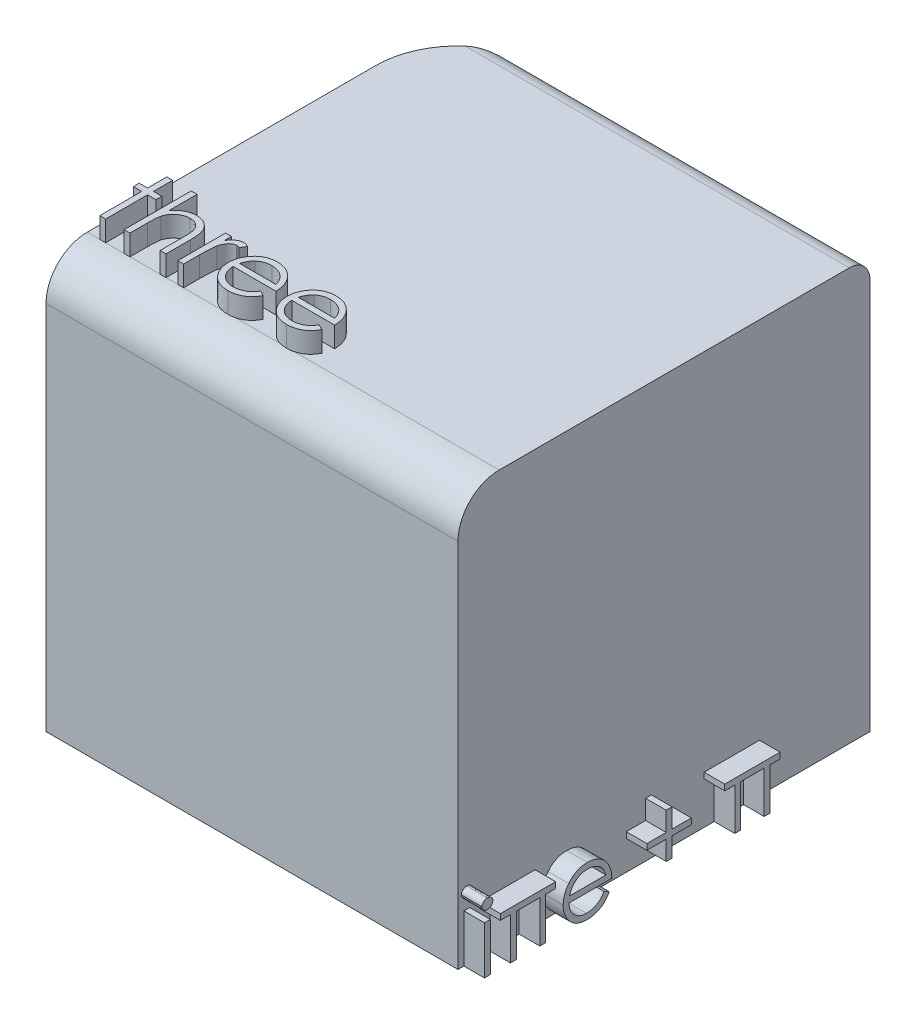
from build123d import *
from OCP.BRepFilletAPI import BRepFilletAPI_MakeFillet

# Parameters (mm, degrees)
SKETCH2_W           = 20
SKETCH2_H           = 20
BOSS_EXTRUDE1_DEPTH = 20
SKETCH3_W           = 0.284935898
SKETCH3_H           = 2.320192308
BOSS_EXTRUDE2_DEPTH = 1
FILLET1_R1          = 2
FILLET1_R2          = 1
FILLET1_R3          = 4
BOSS_EXTRUDE3_DEPTH = 1
SKETCH5_R           = 0.869274054
SKETCH5_R_2         = 1.87334708
SKETCH5_R_3         = 1.224259222
SKETCH5_R_4         = 0.854359486
SKETCH5_R_5         = 0.723058737
SKETCH5_R_6         = 0.828150602
SKETCH5_R_7         = 1.20534194
SKETCH5_R_8         = 2.196982283
SKETCH5_R_9         = 1.648859169
SKETCH5_R_10        = 0.887298728
SKETCH5_R_11        = 1.198491665
SKETCH5_R_12        = 1.240938395
SKETCH5_R_13        = 1.52286101
SKETCH5_R_14        = 2.08407997
SKETCH5_R_15        = 1.116428312
SKETCH5_R_16        = 0.510356374
SKETCH5_R_17        = 0.928303522
SKETCH5_R_18        = 1.048285303
SKETCH5_R_19        = 1.120954627
SKETCH5_R_20        = 1.035138007
SKETCH5_R_21        = 1.063032749
SKETCH5_R_22        = 0.901829478
SKETCH5_R_23        = 0.83084329
SKETCH5_R_24        = 0.806786337
SKETCH5_R_25        = 0.775997991
SKETCH5_R_26        = 0.848871038
SKETCH5_R_27        = 0.739481873
SKETCH5_R_28        = 1.066466648
SKETCH5_R_29        = 0.843889534
SKETCH5_R_30        = 0.704115082
SKETCH5_R_31        = 0.319725843
SKETCH5_R_32        = 0.681387214
SKETCH5_R_33        = 0.790534868
SKETCH5_R_34        = 0.573713006
SKETCH5_R_35        = 0.533233324
SKETCH5_R_36        = 0.625054899
SKETCH5_R_37        = 0.340042365
SKETCH5_R_38        = 0.519725647
SKETCH5_R_39        = 0.813729973
SKETCH5_R_40        = 0.720290961
SKETCH5_R_41        = 0.811333119
SKETCH5_R_42        = 0.907849135
SKETCH5_R_43        = 0.760866236
SKETCH5_R_44        = 0.443440105
SKETCH5_R_45        = 0.505502597
SKETCH5_R_46        = 0.653372918
SKETCH5_R_47        = 0.821463246
SKETCH5_R_48        = 0.243410693
SKETCH5_R_49        = 0.331818637
SKETCH5_R_50        = 0.58557289
SKETCH5_R_51        = 0.913548579
SKETCH5_R_52        = 0.618089992
SKETCH5_R_53        = 0.33645039
SKETCH5_R_54        = 0.353045631
SKETCH5_R_55        = 0.558214156
SKETCH5_R_56        = 0.708578995
SKETCH5_R_57        = 0.386937988
SKETCH5_R_58        = 0.620695254
SKETCH5_R_59        = 0.450911284
SKETCH5_R_60        = 0.446571325
SKETCH5_R_61        = 0.637073751
SKETCH5_R_62        = 0.354108624
SKETCH5_R_63        = 0.719749999
SKETCH5_RX          = 0.571418379
SKETCH5_RY          = 0.334928494
BOSS_EXTRUDE4_DEPTH = 4


with BuildPart() as part:
    # Sketch2 → Boss-Extrude1 (new body)
    with BuildSketch(Plane(origin=(0, 0, 0), x_dir=(1, 0, 0), z_dir=(0, 1, 0))):
        with Locations((10, -10)):
            Rectangle(SKETCH2_W, SKETCH2_H)
    extrude(amount=BOSS_EXTRUDE1_DEPTH)

    # Sketch3 → Boss-Extrude2 (add)
    # profile 1 of 6: a face of its own
    with BuildSketch(Plane(origin=(20, 0, 0), x_dir=(0, 0, -1), z_dir=(1, 0, 0))):
        with BuildLine():
            add(Edge.make_bspline(
                [(-19.573868189, 3.297115385), (-19.556186781, 3.296295189), (-19.521563189, 3.294689089), (-19.47149501, 3.280935463), (-19.425904721, 3.257622177), (-19.385466349, 3.226344181), (-19.350766423, 3.189560043), (-19.326472493, 3.146687593), (-19.310858391, 3.100370114), (-19.308972844, 3.06806214), (-19.308012821, 3.05161258)],
                knots=[0, 0, 0, 0, 1.055194115, 2.066272739, 3.074728998, 4.095836921, 5.109056067, 6.073838105, 7.019297344, 8, 8, 8, 8], degree=3))
            add(Edge.make_bspline(
                [(-19.308012821, 3.05161258), (-19.308994494, 3.03559003), (-19.310935147, 3.003915346), (-19.326460432, 2.958400839), (-19.350973462, 2.916124096), (-19.385444098, 2.879411381), (-19.425910617, 2.848150675), (-19.471493444, 2.824832805), (-19.521563601, 2.811080395), (-19.55618692, 2.809474127), (-19.573868189, 2.808653846)],
                knots=[0, 0, 0, 0, 0.96129708, 1.900370562, 2.859976407, 3.87933698, 4.906634145, 5.921202961, 6.938410037, 8, 8, 8, 8], degree=3))
            add(Edge.make_bspline(
                [(-19.573868189, 2.808653846), (-19.591347267, 2.809442807), (-19.625368009, 2.810978415), (-19.674686502, 2.825102646), (-19.71988806, 2.848158655), (-19.760405299, 2.879206694), (-19.794178403, 2.916349565), (-19.818760455, 2.958375039), (-19.834249885, 3.003921915), (-19.836195369, 3.035592237), (-19.837179487, 3.05161258)],
                knots=[0, 0, 0, 0, 1.054934014, 2.053291228, 3.073705704, 4.106921865, 5.123545215, 6.088680038, 7.033164197, 8, 8, 8, 8], degree=3))
            add(Edge.make_bspline(
                [(-19.837179487, 3.05161258), (-19.83621693, 3.068059851), (-19.834326407, 3.100363328), (-19.818748845, 3.146713822), (-19.794383162, 3.189332756), (-19.760382936, 3.226548745), (-19.719894012, 3.257614247), (-19.674684964, 3.280665637), (-19.625368416, 3.294791066), (-19.591347405, 3.296326509), (-19.573868189, 3.297115385)],
                knots=[0, 0, 0, 0, 0.98631895, 1.937192651, 2.907499808, 3.917963147, 4.944918757, 5.95915025, 6.951458133, 8, 8, 8, 8], degree=3))
        make_face()
    # profile 2 of 6: a face of its own
    with BuildSketch(Plane(origin=(20, 0, 0), x_dir=(0, 0, -1), z_dir=(1, 0, 0))):
        with Locations((-19.572596154, 1.160096154)):
            Rectangle(SKETCH3_W, SKETCH3_H)
    # profile 3 of 6: a face of its own
    with BuildSketch(Plane(origin=(20, 0, 0), x_dir=(0, 0, -1), z_dir=(1, 0, 0))):
        Polygon((-16.256585145, 2.03525641), (-16.745046683, 2.03525641), (-16.745046683, 0), (-17.029982581, 0), (-17.029982581, 2.03525641), (-18.169726171, 2.03525641), (-18.169726171, 0), (-18.454662068, 0), (-18.454662068, 2.03525641), (-18.943123606, 2.03525641), (-18.943123606, 2.320192308), (-16.256585145, 2.320192308), align=None)
    # profile 4 of 6: a face of its own
    with BuildSketch(Plane(origin=(20, 0, 0), x_dir=(0, 0, -1), z_dir=(1, 0, 0))):
        with BuildLine():
            Line((-13.909152811, 0.732692308), (-13.656017795, 0.599764623))
            add(Edge.make_bspline(
                [(-13.656017795, 0.599764623), (-13.676189563, 0.563983887), (-13.715435837, 0.494368744), (-13.782927944, 0.398726985), (-13.853677895, 0.312686557), (-13.930879352, 0.238546085), (-14.012222561, 0.1739109), (-14.098158612, 0.117361587), (-14.189134897, 0.069175501), (-14.285155718, 0.028578565), (-14.387027454, -0.002635762), (-14.494996972, -0.024683162), (-14.609271115, -0.038311413), (-14.687599435, -0.039894505), (-14.727707498, -0.040705128)],
                knots=[0, 0, 0, 0, 1.120438281, 2.179929193, 3.190490725, 4.156257408, 5.095198341, 6.022838206, 6.959905092, 7.901321166, 8.864066838, 9.862729781, 10.905609505, 12, 12, 12, 12], degree=3))
            add(Edge.make_bspline(
                [(-14.727707498, -0.040705128), (-14.772286292, -0.039664476), (-14.859246605, -0.037634466), (-14.985829089, -0.020133445), (-15.10500899, 0.008416481), (-15.216779607, 0.048299508), (-15.320867222, 0.100394295), (-15.417478712, 0.163857539), (-15.507122139, 0.238363227), (-15.586972671, 0.324556715), (-15.658858193, 0.416796776), (-15.722290902, 0.5129139), (-15.775320143, 0.612666254), (-15.818457153, 0.7154188), (-15.853295852, 0.820523904), (-15.877577076, 0.928937878), (-15.891574062, 1.040367301), (-15.893718952, 1.115748455), (-15.894799846, 1.153735978)],
                knots=[0, 0, 0, 0, 1.145258523, 2.234067595, 3.276747158, 4.290159414, 5.277019952, 6.260822364, 7.254936242, 8.264827045, 9.274100331, 10.257902744, 11.220704747, 12.172965371, 13.118907548, 14.062713208, 15.023725156, 16, 16, 16, 16], degree=3))
            add(Edge.make_bspline(
                [(-15.894799846, 1.153735978), (-15.893839054, 1.189382002), (-15.89193489, 1.260027716), (-15.879932675, 1.364590031), (-15.858661724, 1.466215842), (-15.829473201, 1.564989591), (-15.791780285, 1.660745898), (-15.745668201, 1.753543042), (-15.691065115, 1.843282276), (-15.648907761, 1.899890833), (-15.627672442, 1.928405449)],
                knots=[0, 0, 0, 0, 1.024358464, 2.0301432, 3.019427413, 4.004406732, 4.986367066, 5.972626655, 6.978780325, 8, 8, 8, 8], degree=3))
            add(Edge.make_bspline(
                [(-15.627672442, 1.928405449), (-15.598909044, 1.962757924), (-15.5422934, 2.030374674), (-15.446538706, 2.119218727), (-15.342852099, 2.193644152), (-15.232532981, 2.25533634), (-15.11429918, 2.302211719), (-14.989740037, 2.337143598), (-14.857437256, 2.356717936), (-14.766990377, 2.359482757), (-14.720711304, 2.360897436)],
                knots=[0, 0, 0, 0, 1.030682036, 2.02871468, 2.997146059, 3.962720338, 4.930598197, 5.918074684, 6.934738563, 8, 8, 8, 8], degree=3))
            add(Edge.make_bspline(
                [(-14.720711304, 2.360897436), (-14.673133834, 2.35966912), (-14.579797682, 2.357259445), (-14.443697115, 2.334919842), (-14.314918465, 2.299493596), (-14.193513265, 2.249461229), (-14.079469206, 2.18490935), (-13.973527575, 2.104952108), (-13.87387656, 2.012044272), (-13.815902349, 1.940594789), (-13.786401409, 1.904236779)],
                knots=[0, 0, 0, 0, 1.056321875, 2.072262726, 3.055038591, 4.01806755, 4.982017516, 5.957941055, 6.960871419, 8, 8, 8, 8], degree=3))
            add(Edge.make_bspline(
                [(-13.786401409, 1.904236779), (-13.766329115, 1.876837816), (-13.726318134, 1.822222265), (-13.676201121, 1.733167001), (-13.632696913, 1.639993819), (-13.597923441, 1.541196621), (-13.56976618, 1.437946002), (-13.549394637, 1.329503836), (-13.537447911, 1.215902417), (-13.535099593, 1.138499042), (-13.53390241, 1.099038462)],
                knots=[0, 0, 0, 0, 0.94817472, 1.890038105, 2.849395472, 3.817997239, 4.812318967, 5.836947057, 6.897266129, 8, 8, 8, 8], degree=3))
            Line((-13.53390241, 1.099038462), (-15.609863949, 1.099038462))
            add(Edge.make_bspline(
                [(-15.609863949, 1.099038462), (-15.608467306, 1.068467326), (-15.605720864, 1.008350421), (-15.592916412, 0.920384068), (-15.572733596, 0.836588251), (-15.544368089, 0.757591491), (-15.510017451, 0.682362018), (-15.467938979, 0.611457885), (-15.417738098, 0.545202048), (-15.361744071, 0.483001859), (-15.29941692, 0.427611026), (-15.233846142, 0.378034057), (-15.164092694, 0.336481837), (-15.090706576, 0.302754366), (-15.013806456, 0.276350779), (-14.933368108, 0.258327828), (-14.849549816, 0.246256381), (-14.792412758, 0.244914113), (-14.763324485, 0.244230769)],
                knots=[0, 0, 0, 0, 1.094153842, 2.151609401, 3.174256925, 4.172055639, 5.149267565, 6.128595816, 7.11444997, 8.118368179, 9.117203808, 10.09244225, 11.054858984, 12.015122123, 12.976791628, 13.957293641, 14.960065497, 16, 16, 16, 16], degree=3))
            add(Edge.make_bspline(
                [(-14.763324485, 0.244230769), (-14.734884516, 0.244782363), (-14.678454161, 0.245876832), (-14.594415669, 0.256519351), (-14.511739097, 0.273728102), (-14.430766634, 0.297214021), (-14.353141652, 0.325858737), (-14.281254617, 0.360423472), (-14.21514185, 0.398659314), (-14.153350031, 0.442392376), (-14.093414201, 0.495921231), (-14.033957803, 0.56271935), (-13.970206839, 0.641720179), (-13.930301994, 0.701179461), (-13.909152811, 0.732692308)],
                knots=[0, 0, 0, 0, 0.99110716, 1.966546729, 2.947904876, 3.932708344, 4.903319531, 5.828989031, 6.710028674, 7.56322171, 8.463672341, 9.504779593, 10.677557249, 12, 12, 12, 12], degree=3))
        make_face()
        with BuildLine():
            add(Edge.make_bspline(
                [(-13.818838308, 1.383974359), (-13.829267388, 1.421768537), (-13.849340012, 1.494510165), (-13.891283, 1.595240115), (-13.938519326, 1.68476414), (-13.994419039, 1.762397092), (-14.057754598, 1.831343136), (-14.130911299, 1.891594282), (-14.212949574, 1.945494398), (-14.303445366, 1.990989879), (-14.399277556, 2.02971568), (-14.499613173, 2.055682749), (-14.60199131, 2.073471405), (-14.671237412, 2.075127947), (-14.706082899, 2.075961538)],
                knots=[0, 0, 0, 0, 1.154881502, 2.222775134, 3.210006277, 4.132804581, 5.035138423, 5.962687519, 6.919655026, 7.923214229, 8.944639381, 9.960483929, 10.97369054, 12, 12, 12, 12], degree=3))
            add(Edge.make_bspline(
                [(-14.706082899, 2.075961538), (-14.734521318, 2.075406665), (-14.790738094, 2.074309797), (-14.873561206, 2.063904751), (-14.953099219, 2.046705463), (-15.029939015, 2.023151538), (-15.10307366, 1.991756592), (-15.174007485, 1.954941807), (-15.240936845, 1.910000514), (-15.282793592, 1.875747838), (-15.303939469, 1.85844351)],
                knots=[0, 0, 0, 0, 1.04873581, 2.073130211, 3.073294108, 4.04793562, 5.032784715, 6.005352987, 6.992311501, 8, 8, 8, 8], degree=3))
            add(Edge.make_bspline(
                [(-15.303939469, 1.85844351), (-15.319082661, 1.844750809), (-15.34972879, 1.81704012), (-15.390677691, 1.769297911), (-15.429884835, 1.717816137), (-15.465566077, 1.660625203), (-15.498293602, 1.598376353), (-15.528918724, 1.531594641), (-15.55648354, 1.459773302), (-15.571992154, 1.409724017), (-15.57997112, 1.383974359)],
                knots=[0, 0, 0, 0, 0.879870761, 1.780643979, 2.707998968, 3.669668524, 4.684282772, 5.740141944, 6.837334558, 8, 8, 8, 8], degree=3))
            Line((-15.57997112, 1.383974359), (-13.818838308, 1.383974359))
        make_face(mode=Mode.SUBTRACT)
    # profile 5 of 6: a face of its own
    with BuildSketch(Plane(origin=(20, 0, 0), x_dir=(0, 0, -1), z_dir=(1, 0, 0))):
        Polygon((-10.894403598, 1.709615385), (-10.894403598, 2.645833333), (-10.6094677, 2.645833333), (-10.6094677, 1.709615385), (-9.673249751, 1.709615385), (-9.673249751, 1.424679487), (-10.6094677, 1.424679487), (-10.6094677, 0.488461538), (-10.894403598, 0.488461538), (-10.894403598, 1.424679487), (-11.830621546, 1.424679487), (-11.830621546, 1.709615385), align=None)
    # profile 6 of 6: a face of its own
    with BuildSketch(Plane(origin=(20, 0, 0), x_dir=(0, 0, -1), z_dir=(1, 0, 0))):
        Polygon((-5.364587302, 2.03525641), (-5.85304884, 2.03525641), (-5.85304884, 0), (-6.137984738, 0), (-6.137984738, 2.03525641), (-7.277728327, 2.03525641), (-7.277728327, 0), (-7.562664225, 0), (-7.562664225, 2.03525641), (-8.051125763, 2.03525641), (-8.051125763, 2.320192308), (-5.364587302, 2.320192308), align=None)
    extrude(amount=BOSS_EXTRUDE2_DEPTH)

    # Fillet1: one fillet with a radius per group of edges: ONE call of the kernel's fillet builder (fillet() takes one radius for all edges)
    fillet1_edges_1 = [part.edges().sort_by_distance(p)[0] for p in [
        (10, 20, 20),
    ]]
    fillet1_edges_2 = [part.edges().sort_by_distance(p)[0] for p in [
        (10, 20, 0),
    ]]
    fillet1_edges_3 = [part.edges().sort_by_distance(p)[0] for p in [
        (0, 10, 0),
    ]]
    fillet1 = BRepFilletAPI_MakeFillet(part.part.solid().wrapped)
    for e in fillet1_edges_1:
        fillet1.Add(FILLET1_R1, e.wrapped)
    for e in fillet1_edges_2:
        fillet1.Add(FILLET1_R2, e.wrapped)
    for e in fillet1_edges_3:
        fillet1.Add(FILLET1_R3, e.wrapped)
    add(Compound.cast(fillet1.Shape()), mode=Mode.REPLACE)

    # Sketch4 → Boss-Extrude3 (add)
    # profile 1 of 5: a face of its own
    with BuildSketch(Plane(origin=(0, 20, 0), x_dir=(1, 0, 0), z_dir=(0, 1, 0))):
        Polygon((0.610576923, -14.743589744), (0.895512821, -14.743589744), (0.895512821, -15.679807692), (1.302564103, -15.679807692), (1.302564103, -15.96474359), (0.895512821, -15.96474359), (0.895512821, -18), (0.610576923, -18), (0.610576923, -15.96474359), (0.203525641, -15.96474359), (0.203525641, -15.679807692), (0.610576923, -15.679807692), align=None)
    # profile 2 of 5: a face of its own
    with BuildSketch(Plane(origin=(0, 20, 0), x_dir=(1, 0, 0), z_dir=(0, 1, 0))):
        with BuildLine():
            Line((1.791025641, -14.743589744), (2.075961538, -14.743589744))
            Line((2.075961538, -14.743589744), (2.075961538, -16.118023838))
            add(Edge.make_bspline(
                [(2.075961538, -16.118023838), (2.106547948, -16.079793226), (2.166101254, -16.005356265), (2.266337017, -15.90823647), (2.369271308, -15.824054864), (2.478459386, -15.757043806), (2.591898072, -15.704106085), (2.710065807, -15.666561577), (2.832984545, -15.643473796), (2.916464502, -15.640572374), (2.958754006, -15.639102564)],
                knots=[0, 0, 0, 0, 1.125788106, 2.19196713, 3.20547328, 4.180437432, 5.132270164, 6.079753143, 7.027236121, 8, 8, 8, 8], degree=3))
            add(Edge.make_bspline(
                [(2.958754006, -15.639102564), (3.001689434, -15.640685919), (3.085724423, -15.643784926), (3.208081178, -15.668289921), (3.322345686, -15.710161311), (3.428178272, -15.767462827), (3.523269248, -15.83883032), (3.607497248, -15.921227487), (3.676295687, -16.01672597), (3.723103457, -16.104951286), (3.753559334, -16.183454299), (3.772837777, -16.250797421), (3.789183764, -16.325838013), (3.803425667, -16.408537449), (3.81291763, -16.499292712), (3.82054182, -16.597694357), (3.825963317, -16.703736743), (3.826173416, -16.777142969), (3.826282051, -16.815099159)],
                knots=[0, 0, 0, 0, 1.235656852, 2.418478516, 3.575258207, 4.727955599, 5.870717718, 6.98870536, 8.107142894, 9.245821548, 9.854588956, 10.528768408, 11.260415777, 12.065282286, 12.943670737, 13.886611085, 14.907229059, 16, 16, 16, 16], degree=3))
            Line((3.826282051, -16.815099159), (3.826282051, -18))
            Line((3.826282051, -18), (3.541346154, -18))
            Line((3.541346154, -18), (3.541346154, -16.90859375))
            add(Edge.make_bspline(
                [(3.541346154, -16.90859375), (3.541173522, -16.877004614), (3.540843306, -16.816579973), (3.5397517, -16.730069289), (3.537314919, -16.651604938), (3.53337717, -16.581438389), (3.529235784, -16.519471821), (3.523535918, -16.465795221), (3.516904491, -16.420334868), (3.510945668, -16.392971241), (3.508273237, -16.380699119)],
                knots=[0, 0, 0, 0, 1.430932559, 2.737130458, 3.918967929, 4.986496826, 5.920444988, 6.731744033, 7.431208747, 8, 8, 8, 8], degree=3))
            add(Edge.make_bspline(
                [(3.508273237, -16.380699119), (3.497909815, -16.344690751), (3.477986196, -16.275464874), (3.431678388, -16.181428259), (3.373839856, -16.101250672), (3.303221269, -16.03601414), (3.221071896, -15.984840815), (3.126856071, -15.949400755), (3.021460524, -15.927404607), (2.947209546, -15.925191811), (2.908508614, -15.924038462)],
                knots=[0, 0, 0, 0, 1.090059168, 2.095632401, 3.037101401, 3.955032261, 4.878929692, 5.839099886, 6.873700383, 8, 8, 8, 8], degree=3))
            add(Edge.make_bspline(
                [(2.908508614, -15.924038462), (2.885587134, -15.924470104), (2.840226117, -15.925324313), (2.772962685, -15.93390035), (2.707712748, -15.947914544), (2.643847916, -15.966877947), (2.582721729, -15.992682113), (2.522552463, -16.022554499), (2.465044859, -16.059119844), (2.409177725, -16.100146076), (2.357182534, -16.145566501), (2.308807222, -16.193506239), (2.265683157, -16.244555671), (2.226613792, -16.297895776), (2.192887776, -16.354258189), (2.163448194, -16.413099392), (2.138469384, -16.474496767), (2.126057227, -16.517109858), (2.119846755, -16.53843149)],
                knots=[0, 0, 0, 0, 1.024319606, 2.027102035, 3.025350316, 4.005802111, 5.00026367, 5.987881639, 7.005602596, 8.042517216, 9.083927026, 10.089214625, 11.084353441, 12.06828073, 13.041928858, 14.016821737, 15.00770877, 16, 16, 16, 16], degree=3))
            add(Edge.make_bspline(
                [(2.119846755, -16.53843149), (2.116273132, -16.553871924), (2.108485767, -16.587518531), (2.100035882, -16.643012382), (2.092472309, -16.707497876), (2.086078268, -16.780877207), (2.082156611, -16.863419262), (2.077930921, -16.954560775), (2.076357923, -17.054872651), (2.076097615, -17.124627861), (2.075961538, -17.161092748)],
                knots=[0, 0, 0, 0, 0.607992626, 1.324890765, 2.152360218, 3.099583803, 4.150613268, 5.323148443, 6.60066238, 8, 8, 8, 8], degree=3))
            Line((2.075961538, -17.161092748), (2.075961538, -18))
            Line((2.075961538, -18), (1.791025641, -18))
            Line((1.791025641, -18), (1.791025641, -14.743589744))
        make_face()
    # profile 3 of 5: a face of its own
    with BuildSketch(Plane(origin=(0, 20, 0), x_dir=(1, 0, 0), z_dir=(0, 1, 0))):
        with BuildLine():
            Line((4.396153846, -15.679807692), (4.681089744, -15.679807692))
            Line((4.681089744, -15.679807692), (4.681089744, -16.021349159))
            add(Edge.make_bspline(
                [(4.681089744, -16.021349159), (4.70212526, -15.989548514), (4.742355523, -15.928730029), (4.80922368, -15.848294306), (4.877715988, -15.781696371), (4.948160337, -15.728625322), (5.021074756, -15.688880564), (5.09485899, -15.659767597), (5.170673881, -15.642552461), (5.221620769, -15.64025407), (5.247145433, -15.639102564)],
                knots=[0, 0, 0, 0, 1.2804753, 2.448899062, 3.506932113, 4.484331642, 5.4025378, 6.288909075, 7.142734305, 8, 8, 8, 8], degree=3))
            add(Edge.make_bspline(
                [(5.247145433, -15.639102564), (5.266945029, -15.640182542), (5.307683985, -15.642404666), (5.369353905, -15.658017343), (5.432893323, -15.682943835), (5.473843917, -15.706384608), (5.495192308, -15.718604768)],
                knots=[0, 0, 0, 0, 0.901110191, 1.854092781, 2.881294221, 4, 4, 4, 4], degree=3))
            Line((5.495192308, -15.718604768), (5.338731971, -15.965379607))
            add(Edge.make_bspline(
                [(5.338731971, -15.965379607), (5.325025931, -15.959265223), (5.299009242, -15.947658951), (5.260950457, -15.933922985), (5.225860958, -15.925834976), (5.20350573, -15.924609682), (5.193083934, -15.924038462)],
                knots=[0, 0, 0, 0, 1.180555205, 2.24091978, 3.179933427, 4, 4, 4, 4], degree=3))
            add(Edge.make_bspline(
                [(5.193083934, -15.924038462), (5.170218733, -15.925562495), (5.123580351, -15.928671083), (5.055105126, -15.95310843), (4.988659447, -15.992592041), (4.935889439, -16.036380835), (4.895029681, -16.078606337), (4.865873905, -16.115480245), (4.839128842, -16.156826575), (4.813574428, -16.201938502), (4.790291432, -16.251586291), (4.768561125, -16.305273921), (4.748913442, -16.363063573), (4.737710006, -16.403324859), (4.731971154, -16.423948317)],
                knots=[0, 0, 0, 0, 1.125678352, 2.296057538, 3.5422874, 4.923748041, 5.663163013, 6.437101912, 7.23742474, 8.08941207, 8.991984279, 9.93940061, 10.944477711, 12, 12, 12, 12], degree=3))
            add(Edge.make_bspline(
                [(4.731971154, -16.423948317), (4.727678197, -16.44234261), (4.718169624, -16.483084572), (4.708924443, -16.551436448), (4.699789952, -16.632193624), (4.693352305, -16.725580891), (4.687385081, -16.831365036), (4.684019507, -16.949707215), (4.681204515, -17.080728898), (4.681129161, -17.172327062), (4.681089744, -17.220242388)],
                knots=[0, 0, 0, 0, 0.566838948, 1.255505196, 2.06880316, 3.007127437, 4.065329342, 5.249902469, 6.561414163, 8, 8, 8, 8], degree=3))
            Line((4.681089744, -17.220242388), (4.681089744, -18))
            Line((4.681089744, -18), (4.396153846, -18))
            Line((4.396153846, -18), (4.396153846, -15.679807692))
        make_face()
    # profile 4 of 5: a face of its own
    with BuildSketch(Plane(origin=(0, 20, 0), x_dir=(1, 0, 0), z_dir=(0, 1, 0))):
        with BuildLine():
            Line((7.684364984, -17.267307692), (7.9375, -17.400235377))
            add(Edge.make_bspline(
                [(7.9375, -17.400235377), (7.917328231, -17.436016113), (7.878081958, -17.505631256), (7.810589851, -17.601273015), (7.739839899, -17.687313443), (7.662638443, -17.761453915), (7.581295234, -17.8260891), (7.495359183, -17.882638413), (7.404382898, -17.930824499), (7.308362076, -17.971421435), (7.206490341, -18.002635762), (7.098520822, -18.024683162), (6.98424668, -18.038311413), (6.90591836, -18.039894505), (6.865810296, -18.040705128)],
                knots=[0, 0, 0, 0, 1.120438281, 2.179929193, 3.190490725, 4.156257408, 5.095198341, 6.022838206, 6.959905092, 7.901321166, 8.864066838, 9.862729781, 10.905609505, 12, 12, 12, 12], degree=3))
            add(Edge.make_bspline(
                [(6.865810296, -18.040705128), (6.821231503, -18.039664476), (6.73427119, -18.037634466), (6.607688705, -18.020133445), (6.488508804, -17.991583519), (6.376738188, -17.951700492), (6.272650573, -17.899605705), (6.176039083, -17.836142461), (6.086395656, -17.761636773), (6.006545124, -17.675443285), (5.934659601, -17.583203224), (5.871226893, -17.4870861), (5.818197652, -17.387333746), (5.775060642, -17.2845812), (5.740221943, -17.179476096), (5.715940718, -17.071062122), (5.701943733, -16.959632699), (5.699798843, -16.884251545), (5.698717949, -16.846264022)],
                knots=[0, 0, 0, 0, 1.145258523, 2.234067595, 3.276747158, 4.290159414, 5.277019952, 6.260822364, 7.254936242, 8.264827045, 9.274100331, 10.257902744, 11.220704747, 12.172965371, 13.118907548, 14.062713208, 15.023725156, 16, 16, 16, 16], degree=3))
            add(Edge.make_bspline(
                [(5.698717949, -16.846264022), (5.699678741, -16.810617998), (5.701582905, -16.739972284), (5.713585119, -16.635409969), (5.734856071, -16.533784158), (5.764044593, -16.435010409), (5.80173751, -16.339254102), (5.847849594, -16.246456958), (5.90245268, -16.156717724), (5.944610034, -16.100109167), (5.965845353, -16.071594551)],
                knots=[0, 0, 0, 0, 1.024358464, 2.0301432, 3.019427413, 4.004406732, 4.986367066, 5.972626655, 6.978780325, 8, 8, 8, 8], degree=3))
            add(Edge.make_bspline(
                [(5.965845353, -16.071594551), (5.994608751, -16.037242076), (6.051224395, -15.969625326), (6.146979089, -15.880781273), (6.250665695, -15.806355848), (6.360984813, -15.74466366), (6.479218615, -15.697788281), (6.603777757, -15.662856402), (6.736080539, -15.643282064), (6.826527418, -15.640517243), (6.87280649, -15.639102564)],
                knots=[0, 0, 0, 0, 1.030682036, 2.02871468, 2.997146059, 3.962720338, 4.930598197, 5.918074684, 6.934738563, 8, 8, 8, 8], degree=3))
            add(Edge.make_bspline(
                [(6.87280649, -15.639102564), (6.920383961, -15.64033088), (7.013720113, -15.642740555), (7.14982068, -15.665080158), (7.27859933, -15.700506404), (7.40000453, -15.750538771), (7.514048589, -15.81509065), (7.61999022, -15.895047892), (7.719641235, -15.987955728), (7.777615446, -16.059405211), (7.807116386, -16.095763221)],
                knots=[0, 0, 0, 0, 1.056321875, 2.072262726, 3.055038591, 4.01806755, 4.982017516, 5.957941055, 6.960871419, 8, 8, 8, 8], degree=3))
            add(Edge.make_bspline(
                [(7.807116386, -16.095763221), (7.82718868, -16.123162184), (7.867199661, -16.177777735), (7.917316673, -16.266832999), (7.960820882, -16.360006181), (7.995594353, -16.458803379), (8.023751615, -16.562053998), (8.044123158, -16.670496164), (8.056069883, -16.784097583), (8.058418202, -16.861500958), (8.059615385, -16.900961538)],
                knots=[0, 0, 0, 0, 0.94817472, 1.890038105, 2.849395472, 3.817997239, 4.812318967, 5.836947057, 6.897266129, 8, 8, 8, 8], degree=3))
            Line((8.059615385, -16.900961538), (5.983653846, -16.900961538))
            add(Edge.make_bspline(
                [(5.983653846, -16.900961538), (5.985050489, -16.931532674), (5.987796931, -16.991649579), (6.000601383, -17.079615932), (6.020784199, -17.163411749), (6.049149706, -17.242408509), (6.083500344, -17.317637982), (6.125578815, -17.388542115), (6.175779696, -17.454797952), (6.231773724, -17.516998141), (6.294100875, -17.572388974), (6.359671652, -17.621965943), (6.429425101, -17.663518163), (6.502811219, -17.697245634), (6.579711339, -17.723649221), (6.660149687, -17.741672172), (6.743967978, -17.753743619), (6.801105037, -17.755085887), (6.830193309, -17.755769231)],
                knots=[0, 0, 0, 0, 1.094153842, 2.151609401, 3.174256925, 4.172055639, 5.149267565, 6.128595816, 7.11444997, 8.118368179, 9.117203808, 10.09244225, 11.054858984, 12.015122123, 12.976791628, 13.957293641, 14.960065497, 16, 16, 16, 16], degree=3))
            add(Edge.make_bspline(
                [(6.830193309, -17.755769231), (6.858633279, -17.755217637), (6.915063634, -17.754123168), (6.999102126, -17.743480649), (7.081778698, -17.726271898), (7.162751161, -17.702785979), (7.240376143, -17.674141263), (7.312263177, -17.639576528), (7.378375944, -17.601340686), (7.440167764, -17.557607624), (7.500103594, -17.504078769), (7.559559992, -17.43728065), (7.623310956, -17.358279821), (7.663215801, -17.298820539), (7.684364984, -17.267307692)],
                knots=[0, 0, 0, 0, 0.99110716, 1.966546729, 2.947904876, 3.932708344, 4.903319531, 5.828989031, 6.710028674, 7.56322171, 8.463672341, 9.504779593, 10.677557249, 12, 12, 12, 12], degree=3))
        make_face()
        with BuildLine():
            add(Edge.make_bspline(
                [(7.774679487, -16.616025641), (7.764250406, -16.578231463), (7.744177783, -16.505489835), (7.702234795, -16.404759885), (7.654998469, -16.31523586), (7.599098755, -16.237602908), (7.535763197, -16.168656864), (7.462606496, -16.108405718), (7.380568221, -16.054505602), (7.290072429, -16.009010121), (7.194240238, -15.97028432), (7.093904621, -15.944317251), (6.991526485, -15.926528595), (6.922280383, -15.924872053), (6.887434896, -15.924038462)],
                knots=[0, 0, 0, 0, 1.154881502, 2.222775134, 3.210006277, 4.132804581, 5.035138423, 5.962687519, 6.919655026, 7.923214229, 8.944639381, 9.960483929, 10.97369054, 12, 12, 12, 12], degree=3))
            add(Edge.make_bspline(
                [(6.887434896, -15.924038462), (6.858996477, -15.924593335), (6.802779701, -15.925690203), (6.719956589, -15.936095249), (6.640418576, -15.953294537), (6.56357878, -15.976848462), (6.490444135, -16.008243408), (6.419510309, -16.045058193), (6.35258095, -16.089999486), (6.310724203, -16.124252162), (6.289578325, -16.14155649)],
                knots=[0, 0, 0, 0, 1.04873581, 2.073130211, 3.073294108, 4.04793562, 5.032784715, 6.005352987, 6.992311501, 8, 8, 8, 8], degree=3))
            add(Edge.make_bspline(
                [(6.289578325, -16.14155649), (6.274435134, -16.155249191), (6.243789005, -16.18295988), (6.202840103, -16.230702089), (6.16363296, -16.282183863), (6.127951718, -16.339374797), (6.095224193, -16.401623647), (6.064599071, -16.468405359), (6.037034254, -16.540226698), (6.02152564, -16.590275983), (6.013546675, -16.616025641)],
                knots=[0, 0, 0, 0, 0.879870761, 1.780643979, 2.707998968, 3.669668524, 4.684282772, 5.740141944, 6.837334558, 8, 8, 8, 8], degree=3))
            Line((6.013546675, -16.616025641), (7.774679487, -16.616025641))
        make_face(mode=Mode.SUBTRACT)
    # profile 5 of 5: a face of its own
    with BuildSketch(Plane(origin=(0, 20, 0), x_dir=(1, 0, 0), z_dir=(0, 1, 0))):
        with BuildLine():
            Line((10.533723958, -17.267307692), (10.786858974, -17.400235377))
            add(Edge.make_bspline(
                [(10.786858974, -17.400235377), (10.766687206, -17.436016113), (10.727440932, -17.505631256), (10.659948825, -17.601273015), (10.589198874, -17.687313443), (10.511997417, -17.761453915), (10.430654208, -17.8260891), (10.344718157, -17.882638413), (10.253741873, -17.930824499), (10.157721051, -17.971421435), (10.055849315, -18.002635762), (9.947879797, -18.024683162), (9.833605654, -18.038311413), (9.755277334, -18.039894505), (9.715169271, -18.040705128)],
                knots=[0, 0, 0, 0, 1.120438281, 2.179929193, 3.190490725, 4.156257408, 5.095198341, 6.022838206, 6.959905092, 7.901321166, 8.864066838, 9.862729781, 10.905609505, 12, 12, 12, 12], degree=3))
            add(Edge.make_bspline(
                [(9.715169271, -18.040705128), (9.670590477, -18.039664476), (9.583630165, -18.037634466), (9.45704768, -18.020133445), (9.337867779, -17.991583519), (9.226097162, -17.951700492), (9.122009547, -17.899605705), (9.025398058, -17.836142461), (8.93575463, -17.761636773), (8.855904098, -17.675443285), (8.784018576, -17.583203224), (8.720585868, -17.4870861), (8.667556627, -17.387333746), (8.624419616, -17.2845812), (8.589580917, -17.179476096), (8.565299693, -17.071062122), (8.551302707, -16.959632699), (8.549157817, -16.884251545), (8.548076923, -16.846264022)],
                knots=[0, 0, 0, 0, 1.145258523, 2.234067595, 3.276747158, 4.290159414, 5.277019952, 6.260822364, 7.254936242, 8.264827045, 9.274100331, 10.257902744, 11.220704747, 12.172965371, 13.118907548, 14.062713208, 15.023725156, 16, 16, 16, 16], degree=3))
            add(Edge.make_bspline(
                [(8.548076923, -16.846264022), (8.549037716, -16.810617998), (8.550941879, -16.739972284), (8.562944094, -16.635409969), (8.584215045, -16.533784158), (8.613403568, -16.435010409), (8.651096484, -16.339254102), (8.697208568, -16.246456958), (8.751811654, -16.156717724), (8.793969008, -16.100109167), (8.815204327, -16.071594551)],
                knots=[0, 0, 0, 0, 1.024358464, 2.0301432, 3.019427413, 4.004406732, 4.986367066, 5.972626655, 6.978780325, 8, 8, 8, 8], degree=3))
            add(Edge.make_bspline(
                [(8.815204327, -16.071594551), (8.843967725, -16.037242076), (8.900583369, -15.969625326), (8.996338063, -15.880781273), (9.10002467, -15.806355848), (9.210343788, -15.74466366), (9.328577589, -15.697788281), (9.453136732, -15.662856402), (9.585439514, -15.643282064), (9.675886392, -15.640517243), (9.722165465, -15.639102564)],
                knots=[0, 0, 0, 0, 1.030682036, 2.02871468, 2.997146059, 3.962720338, 4.930598197, 5.918074684, 6.934738563, 8, 8, 8, 8], degree=3))
            add(Edge.make_bspline(
                [(9.722165465, -15.639102564), (9.769742935, -15.64033088), (9.863079087, -15.642740555), (9.999179654, -15.665080158), (10.127958304, -15.700506404), (10.249363504, -15.750538771), (10.363407564, -15.81509065), (10.469349194, -15.895047892), (10.569000209, -15.987955728), (10.62697442, -16.059405211), (10.656475361, -16.095763221)],
                knots=[0, 0, 0, 0, 1.056321875, 2.072262726, 3.055038591, 4.01806755, 4.982017516, 5.957941055, 6.960871419, 8, 8, 8, 8], degree=3))
            add(Edge.make_bspline(
                [(10.656475361, -16.095763221), (10.676547655, -16.123162184), (10.716558635, -16.177777735), (10.766675648, -16.266832999), (10.810179856, -16.360006181), (10.844953328, -16.458803379), (10.87311059, -16.562053998), (10.893482132, -16.670496164), (10.905428858, -16.784097583), (10.907777176, -16.861500958), (10.908974359, -16.900961538)],
                knots=[0, 0, 0, 0, 0.94817472, 1.890038105, 2.849395472, 3.817997239, 4.812318967, 5.836947057, 6.897266129, 8, 8, 8, 8], degree=3))
            Line((10.908974359, -16.900961538), (8.833012821, -16.900961538))
            add(Edge.make_bspline(
                [(8.833012821, -16.900961538), (8.834409463, -16.931532674), (8.837155906, -16.991649579), (8.849960357, -17.079615932), (8.870143173, -17.163411749), (8.89850868, -17.242408509), (8.932859318, -17.317637982), (8.97493779, -17.388542115), (9.025138671, -17.454797952), (9.081132698, -17.516998141), (9.143459849, -17.572388974), (9.209030627, -17.621965943), (9.278784075, -17.663518163), (9.352170194, -17.697245634), (9.429070313, -17.723649221), (9.509508661, -17.741672172), (9.593326953, -17.753743619), (9.650464011, -17.755085887), (9.679552284, -17.755769231)],
                knots=[0, 0, 0, 0, 1.094153842, 2.151609401, 3.174256925, 4.172055639, 5.149267565, 6.128595816, 7.11444997, 8.118368179, 9.117203808, 10.09244225, 11.054858984, 12.015122123, 12.976791628, 13.957293641, 14.960065497, 16, 16, 16, 16], degree=3))
            add(Edge.make_bspline(
                [(9.679552284, -17.755769231), (9.707992253, -17.755217637), (9.764422609, -17.754123168), (9.848461101, -17.743480649), (9.931137672, -17.726271898), (10.012110135, -17.702785979), (10.089735117, -17.674141263), (10.161622152, -17.639576528), (10.227734919, -17.601340686), (10.289526738, -17.557607624), (10.349462568, -17.504078769), (10.408918966, -17.43728065), (10.472669931, -17.358279821), (10.512574775, -17.298820539), (10.533723958, -17.267307692)],
                knots=[0, 0, 0, 0, 0.99110716, 1.966546729, 2.947904876, 3.932708344, 4.903319531, 5.828989031, 6.710028674, 7.56322171, 8.463672341, 9.504779593, 10.677557249, 12, 12, 12, 12], degree=3))
        make_face()
        with BuildLine():
            add(Edge.make_bspline(
                [(10.624038462, -16.616025641), (10.613609381, -16.578231463), (10.593536757, -16.505489835), (10.551593769, -16.404759885), (10.504357443, -16.31523586), (10.44845773, -16.237602908), (10.385122172, -16.168656864), (10.31196547, -16.108405718), (10.229927195, -16.054505602), (10.139431403, -16.009010121), (10.043599213, -15.97028432), (9.943263596, -15.944317251), (9.84088546, -15.926528595), (9.771639357, -15.924872053), (9.73679387, -15.924038462)],
                knots=[0, 0, 0, 0, 1.154881502, 2.222775134, 3.210006277, 4.132804581, 5.035138423, 5.962687519, 6.919655026, 7.923214229, 8.944639381, 9.960483929, 10.97369054, 12, 12, 12, 12], degree=3))
            add(Edge.make_bspline(
                [(9.73679387, -15.924038462), (9.708355451, -15.924593335), (9.652138675, -15.925690203), (9.569315563, -15.936095249), (9.489777551, -15.953294537), (9.412937754, -15.976848462), (9.339803109, -16.008243408), (9.268869284, -16.045058193), (9.201939924, -16.089999486), (9.160083178, -16.124252162), (9.1389373, -16.14155649)],
                knots=[0, 0, 0, 0, 1.04873581, 2.073130211, 3.073294108, 4.04793562, 5.032784715, 6.005352987, 6.992311501, 8, 8, 8, 8], degree=3))
            add(Edge.make_bspline(
                [(9.1389373, -16.14155649), (9.123794108, -16.155249191), (9.093147979, -16.18295988), (9.052199078, -16.230702089), (9.012991935, -16.282183863), (8.977310692, -16.339374797), (8.944583168, -16.401623647), (8.913958045, -16.468405359), (8.886393229, -16.540226698), (8.870884615, -16.590275983), (8.862905649, -16.616025641)],
                knots=[0, 0, 0, 0, 0.879870761, 1.780643979, 2.707998968, 3.669668524, 4.684282772, 5.740141944, 6.837334558, 8, 8, 8, 8], degree=3))
            Line((8.862905649, -16.616025641), (10.624038462, -16.616025641))
        make_face(mode=Mode.SUBTRACT)
    extrude(amount=BOSS_EXTRUDE3_DEPTH)

    # Sketch5 → Boss-Extrude4 (add)
    with BuildSketch(Plane.XY.offset(20)):
        with Locations((2.852466063, 15.587306963)):
            Circle(SKETCH5_R)
        with Locations((10.332535753, 15.280289178)):
            Circle(SKETCH5_R_2)
        with Locations((4.387554992, 9.558594078)):
            Circle(SKETCH5_R_3)
        with Locations((7.150715064, 12.46130769)):
            Circle(SKETCH5_R_4)
        with Locations((2.517537569, 13.315667175)):
            Circle(SKETCH5_R_5)
        with Locations((11.89553539, 8.334334857)):
            Circle(SKETCH5_R_6)
        with Locations((5.057411979, 5.958112772)):
            Circle(SKETCH5_R_7)
        with Locations((13.346892196, 3.836898979)):
            Circle(SKETCH5_R_8)
        with Locations((14.798249001, 13.828932372)):
            Circle(SKETCH5_R_9)
        with Locations((9.411482396, 10.7828533)):
            Circle(SKETCH5_R_10)
        with Locations((8.005074549, 8.107237273)):
            Circle(SKETCH5_R_11)
        with Locations((8.239232668, 4.752770832)):
            Circle(SKETCH5_R_12)
        with Locations((2.517537569, 2.664649252)):
            Circle(SKETCH5_R_13)
        with Locations((16.807819963, 9.162485459)):
            Circle(SKETCH5_R_14)
        with Locations((17.282301996, 3.836898979)):
            Circle(SKETCH5_R_15)
        with Locations((17.673051905, 1.639916696)):
            Circle(SKETCH5_R_16)
        with Locations((7.625197096, 1.639916696)):
            Circle(SKETCH5_R_17)
        with Locations((11.89553539, 11.670152028)):
            Circle(SKETCH5_R_18)
        with Locations((17.673051905, 16.64791386)):
            Circle(SKETCH5_R_19)
        with Locations((5.611814213, 16.456581018)):
            Circle(SKETCH5_R_20)
        with Locations((1.401109257, 7.506184255)):
            Circle(SKETCH5_R_21)
        with Locations((1.205734302, 11.246565429)):
            Circle(SKETCH5_R_22)
        with Locations((4.387554992, 13.315667175)):
            Circle(SKETCH5_R_23)
        with Locations((5.057411979, 1.966881557)):
            Circle(SKETCH5_R_24)
        with Locations((9.858053721, 6.990808961)):
            Circle(SKETCH5_R_25)
        with Locations((13.151517241, 10.144718942)):
            Circle(SKETCH5_R_26)
        with Locations((13.598088566, 7.506184255)):
            Circle(SKETCH5_R_27)
        with Locations((9.858053721, 2.134345803)):
            Circle(SKETCH5_R_28)
        with Locations((17.673051905, 13.828932372)):
            Circle(SKETCH5_R_29)
        with Locations((18.175444645, 12.014736365)):
            Circle(SKETCH5_R_30)
        with Locations((14.337570439, 11.670152028)):
            Circle(SKETCH5_R_31)
        with Locations((13.598088566, 17.038663769)):
            Circle(SKETCH5_R_32)
        with Locations((6.732054447, 14.672821906)):
            Circle(SKETCH5_R_33)
        with Locations((5.224876226, 11.670152028)):
            Circle(SKETCH5_R_34)
        with Locations((0.842895101, 17.038663769)):
            Circle(SKETCH5_R_35)
        with Locations((0.842895101, 14.672821906)):
            Circle(SKETCH5_R_36)
        with Locations((2.852466063, 17.571897093)):
            Circle(SKETCH5_R_37)
        with Locations((7.522589315, 17.231854728)):
            Circle(SKETCH5_R_38)
        with Locations((15.523927404, 1.213292446)):
            Circle(SKETCH5_R_39)
        with Locations((11.588517604, 0.878363952)):
            Circle(SKETCH5_R_40)
        with Locations((15.523927404, 6.181398435)):
            Circle(SKETCH5_R_41)
        with Locations((18.175444645, 6.181398435)):
            Circle(SKETCH5_R_42)
        with Locations((19.08329378, 2.469274297)):
            Circle(SKETCH5_R_43)
        with Locations((16.249605807, 12.014736365)):
            Circle(SKETCH5_R_44)
        with Locations((12.314196007, 13.315667175)):
            Circle(SKETCH5_R_45)
        with Locations((9.244018149, 12.46130769)):
            Circle(SKETCH5_R_46)
        with Locations((6.732054447, 10.144718942)):
            Circle(SKETCH5_R_47)
        with Locations((15.188998911, 16.64791386)):
            Circle(SKETCH5_R_41)
        with Locations((11.80869341, 17.459246979)):
            Circle(SKETCH5_R_48)
        with Locations((12.819698604, 15.587306963)):
            Circle(SKETCH5_R_49)
        with Locations((7.522589315, 15.9191256)):
            Circle(SKETCH5_R_50)
        with Locations((3.159483848, 11.670152028)):
            Circle(SKETCH5_R_51)
        with Locations((1.401109257, 9.558594078)):
            Circle(SKETCH5_R_52)
        with Locations((2.517537569, 10.17668407)):
            Circle(SKETCH5_R_53)
        with Locations((2.517537569, 8.637540721)):
            Circle(SKETCH5_R_54)
        with Locations((0.842895101, 5.511541447)):
            Circle(SKETCH5_R_55)
        with Locations((2.517537569, 5.762737818)):
            Circle(SKETCH5_R)
        with Locations((3.386811623, 7.716487364)):
            Circle(SKETCH5_R_56)
        with Locations((5.224876226, 8.107237273)):
            Circle(SKETCH5_R_57)
        with Locations((5.057411979, 3.836898979)):
            Circle(SKETCH5_R_58)
        with Locations((6.732054447, 6.739612591)):
            Circle(SKETCH5_R_59)
        with Locations((6.281143163, 4.171827473)):
            Circle(SKETCH5_R_59)
        with Locations((10.332535753, 5.511541447)):
            Circle(SKETCH5_R_60)
        with Locations((10.137160799, 4.171827473)):
            Circle(SKETCH5_R_55)
        with Locations((11.588517604, 6.739612591)):
            Circle(SKETCH5_R_61)
        with Locations((9.578946643, 9.162485459)):
            Circle(SKETCH5_R_62)
        with Locations((10.951443853, 9.893522572)):
            Circle(SKETCH5_R_63)
        with Locations((19.08329378, 4.171827473)):
            Ellipse(SKETCH5_RX, SKETCH5_RY)
    extrude(amount=-BOSS_EXTRUDE4_DEPTH)


solid = part.part
